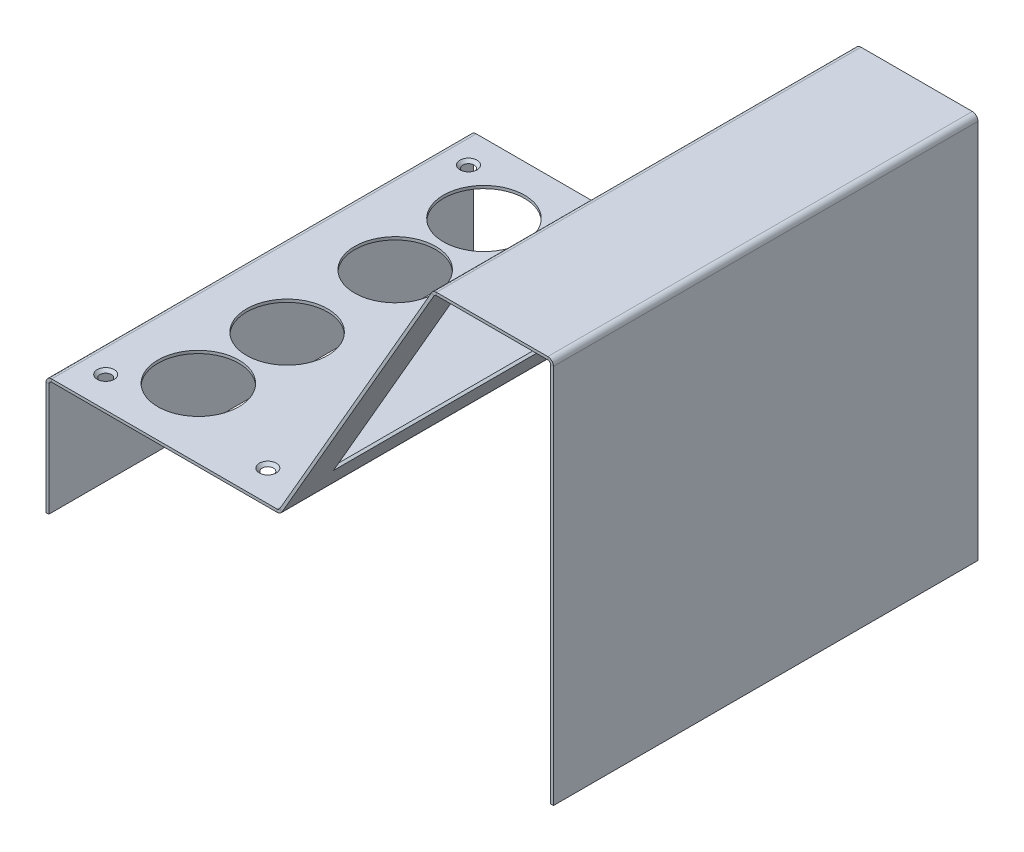
from build123d import *

# Parameters (mm, degrees)
BASE_FLANGE1_DEPTH                              = 55
CUT_EXTRUDE2_REACH                              = 115.264
SKETCH6_R                                       = 10.5
CUT_EXTRUDE3_REACH                              = 115.888
SKETCH7_W                                       = 90.6
SKETCH7_H                                       = 68.2
CSK_FOR_M2_FLAT_HEAD_MACHINE_SCREW1_D           = 2.4
CSK_FOR_M2_FLAT_HEAD_MACHINE_SCREW1_CSINK_D     = 4.4
CSK_FOR_M2_FLAT_HEAD_MACHINE_SCREW1_CSINK_ANGLE = 90


# Sheet-metal steps are written as plain solids
with BuildPart() as part:
    # Sketch1 → Base-Flange1 (new, symmetric)
    with BuildSketch(Plane.XY):
        with BuildLine():
            Line((70, -30), (70, 68.545432303))
            ThreePointArc((70, 68.545432303), (69.784254855, 69.066287158), (69.2634, 69.282032303))
            Line((69.2634, 69.282032303), (40.425276208, 69.282032303))
            ThreePointArc((40.425276208, 69.282032303), (40.056976208, 69.183346615), (39.787361896, 68.913732303))
            Line((39.787361896, 68.913732303), (0.425276208, 0.7366))
            ThreePointArc((0.425276208, 0.7366), (-0.113952417, 0.197371375), (-0.850552417, 0))
            Line((-0.850552417, 0), (-59.2634, 0))
            ThreePointArc((-59.2634, 0), (-59.784254855, -0.215745145), (-60, -0.7366))
            Line((-60, -0.7366), (-60, -30))
            Line((-60, -30), (-60.7366, -30))
            Line((-60.7366, -30), (-60.7366, -0.7366))
            ThreePointArc((-60.7366, -0.7366), (-60.30510971, 0.30510971), (-59.2634, 0.7366))
            Line((-59.2634, 0.7366), (-0.850552417, 0.7366))
            ThreePointArc((-0.850552417, 0.7366), (-0.482252417, 0.835285688), (-0.212638104, 1.1049))
            Line((-0.212638104, 1.1049), (39.149447583, 69.282032303))
            ThreePointArc((39.149447583, 69.282032303), (39.688676208, 69.821260928), (40.425276208, 70.018632303))
            Line((40.425276208, 70.018632303), (69.2634, 70.018632303))
            ThreePointArc((69.2634, 70.018632303), (70.30510971, 69.587142013), (70.7366, 68.545432303))
            Line((70.7366, 68.545432303), (70.7366, -30))
            Line((70.7366, -30), (70, -30))
        make_face()
    extrude(amount=BASE_FLANGE1_DEPTH, both=True)

    # Sketch6 → Cut-Extrude2 (cut, up to next)
    with BuildSketch(Plane(origin=(0, 0.7366, 0), x_dir=(1, 0, 0), z_dir=(0, 1, 0)), mode=Mode.PRIVATE) as cut_extrude2_sk1:
        with Locations(Location((-39.2634, 14, 0), (0, 0, 180))):
            Circle(SKETCH6_R)
    cut_extrude2_tool1 = extrude(cut_extrude2_sk1.sketch, amount=-CUT_EXTRUDE2_REACH, mode=Mode.PRIVATE) & part.part
    # Sketch6 → Cut-Extrude2 (cut, up to next)
    with BuildSketch(Plane(origin=(0, 0.7366, 0), x_dir=(1, 0, 0), z_dir=(0, 1, 0)), mode=Mode.PRIVATE) as cut_extrude2_sk2:
        with Locations(Location((-39.2634, 37, 0), (0, 0, 180))):
            Circle(SKETCH6_R)
    cut_extrude2_tool2 = extrude(cut_extrude2_sk2.sketch, amount=-CUT_EXTRUDE2_REACH, mode=Mode.PRIVATE) & part.part
    # Sketch6 → Cut-Extrude2 (cut, up to next)
    with BuildSketch(Plane(origin=(0, 0.7366, 0), x_dir=(1, 0, 0), z_dir=(0, 1, 0)), mode=Mode.PRIVATE) as cut_extrude2_sk3:
        with Locations(Location((-39.2634, -14, 0), (0, 0, 180))):
            Circle(SKETCH6_R)
    cut_extrude2_tool3 = extrude(cut_extrude2_sk3.sketch, amount=-CUT_EXTRUDE2_REACH, mode=Mode.PRIVATE) & part.part
    # Sketch6 → Cut-Extrude2 (cut, up to next)
    with BuildSketch(Plane(origin=(0, 0.7366, 0), x_dir=(1, 0, 0), z_dir=(0, 1, 0)), mode=Mode.PRIVATE) as cut_extrude2_sk4:
        with Locations(Location((-39.2634, -37, 0), (0, 0, 180))):
            Circle(SKETCH6_R)
    cut_extrude2_tool4 = extrude(cut_extrude2_sk4.sketch, amount=-CUT_EXTRUDE2_REACH, mode=Mode.PRIVATE) & part.part
    add(cut_extrude2_tool1.solids().sort_by_distance((-39.2634, 0.7366, -14))[0], mode=Mode.SUBTRACT)
    add(cut_extrude2_tool2.solids().sort_by_distance((-39.2634, 0.7366, -37))[0], mode=Mode.SUBTRACT)
    add(cut_extrude2_tool3.solids().sort_by_distance((-39.2634, 0.7366, 14))[0], mode=Mode.SUBTRACT)
    add(cut_extrude2_tool4.solids().sort_by_distance((-39.2634, 0.7366, 37))[0], mode=Mode.SUBTRACT)

    # Sketch7 → Cut-Extrude3 (cut, up to next)
    with BuildSketch(Plane(origin=(-0.637914312, 0.3683, 0), x_dir=(0, 0, 1), z_dir=(-0.8660254037844365, 0.500000000000004, 0)), mode=Mode.PRIVATE) as cut_extrude3_sk1:
        with Locations((0, 42.174723792)):
            Rectangle(SKETCH7_W, SKETCH7_H)
    cut_extrude3_tool1 = extrude(cut_extrude3_sk1.sketch, amount=-CUT_EXTRUDE3_REACH, mode=Mode.PRIVATE) & part.part
    add(cut_extrude3_tool1.solids().sort_by_distance((20.449448, 36.892682, 0))[0], mode=Mode.SUBTRACT)

    # CSK for M2 Flat Head Machine Screw1 (through all)
    with Locations(Plane(origin=(0, 0.7366, 0), x_dir=(1, 0, 0), z_dir=(0, 1, 0))):
        with Locations((-53.2634, 47), (-11.2634, 47), (-11.2634, -47), (-53.2634, -47)):
            CounterSinkHole(CSK_FOR_M2_FLAT_HEAD_MACHINE_SCREW1_D / 2, CSK_FOR_M2_FLAT_HEAD_MACHINE_SCREW1_CSINK_D / 2, counter_sink_angle=CSK_FOR_M2_FLAT_HEAD_MACHINE_SCREW1_CSINK_ANGLE)


solid = part.part
